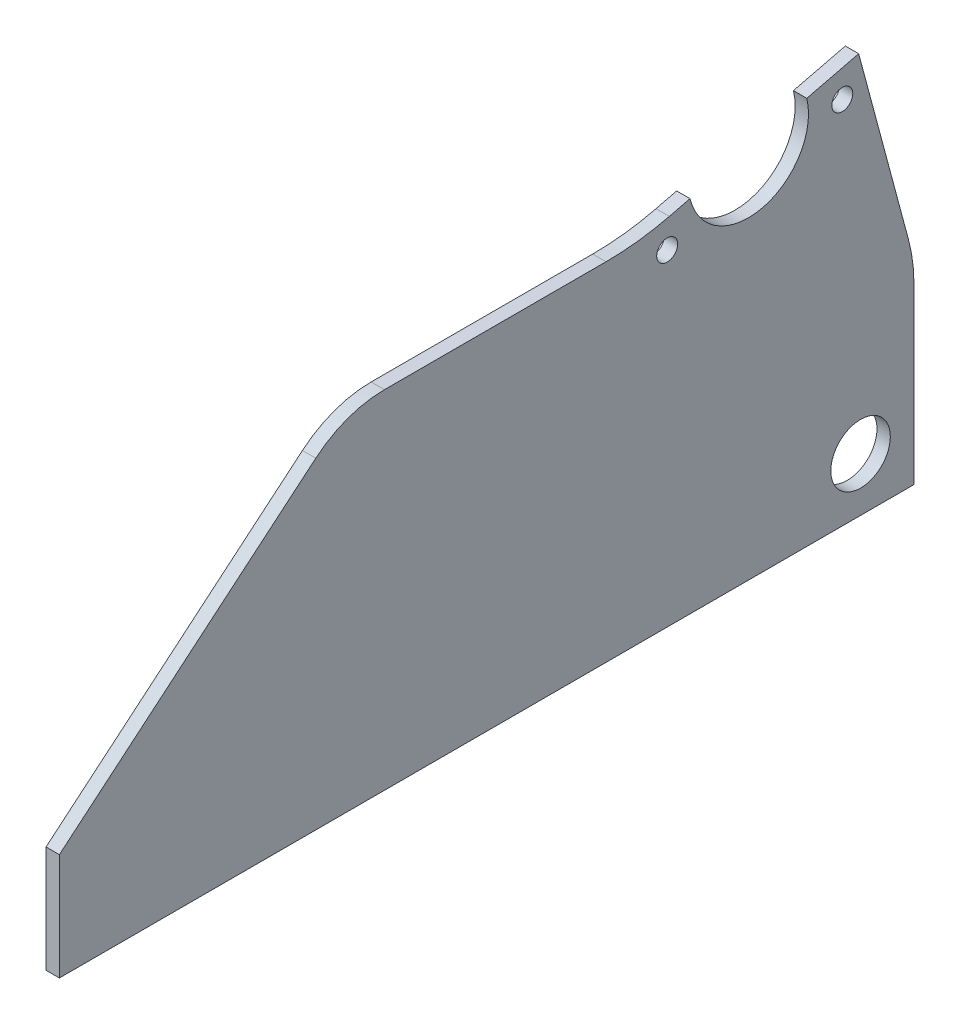
from build123d import *

# Parameters (mm, degrees)
BOSS_EXTRUDE1_DEPTH    = 3.175
F_10_CLEARANCE_HOLE1_D = 4.9784
SKETCH9_R              = 7.0739
CUT_EXTRUDE1_DEPTH     = 215.910494009
FILLET1_R              = 38.1
FILLET2_R              = 63.5


with BuildPart() as part:
    # Sketch1 → Boss-Extrude1 (new body)
    with BuildSketch(Plane(origin=(0, 0, 0), x_dir=(0, 0, -1), z_dir=(1, 0, 0))):
        with BuildLine():
            Line((0, -25.4), (0, 20.832325737))
            Line((0, 20.832325737), (-13.148007491, 69.901357712))
            Line((-13.148007491, 69.901357712), (-25.485569016, 66.888954083))
            ThreePointArc((-25.485569016, 66.888954083), (-35.976371648, 49.620243285), (-53.245082446, 60.111045917))
            Line((-53.245082446, 60.111045917), (-65.582643971, 57.098642288))
            Line((-65.582643971, 57.098642288), (-125.907643971, 57.098642288))
            ThreePointArc((-125.907643971, 57.098642288), (-134.594955611, 55.566834856), (-142.234449257, 51.156171143))
            Line((-142.234449257, 51.156171143), (-203.2, 0))
            Line((-203.2, 0), (-203.2, -25.4))
            Line((-203.2, -25.4), (0, -25.4))
        make_face()
    extrude(amount=BOSS_EXTRUDE1_DEPTH)

    # #10 Clearance Hole1 (through all)
    with Locations(Plane(origin=(3.175, 0, 0), x_dir=(0, 0, -1), z_dir=(1, 0, 0))):
        with Locations((-58.678758989, 52.247788113), (-17.039488844, 62.414650362)):
            Hole(F_10_CLEARANCE_HOLE1_D / 2)

    # Sketch9 → Cut-Extrude1 (cut, through all)
    with BuildSketch(Plane(origin=(3.175, 0, 0), x_dir=(0, 0, -1), z_dir=(1, 0, 0))):
        with Locations((-12.7, -12.7)):
            Circle(SKETCH9_R)
    extrude(amount=-CUT_EXTRUDE1_DEPTH, mode=Mode.SUBTRACT)

    # Fillet1
    fillet1_edges = [part.edges().sort_by_distance(p)[0] for p in [
        (1.5875, 20.832325737, 0),
    ]]
    fillet(fillet1_edges, radius=FILLET1_R)

    # Fillet2
    fillet2_edges = [part.edges().sort_by_distance(p)[0] for p in [
        (1.5875, 57.098642288, 65.582643971),
    ]]
    fillet(fillet2_edges, radius=FILLET2_R)


solid = part.part
